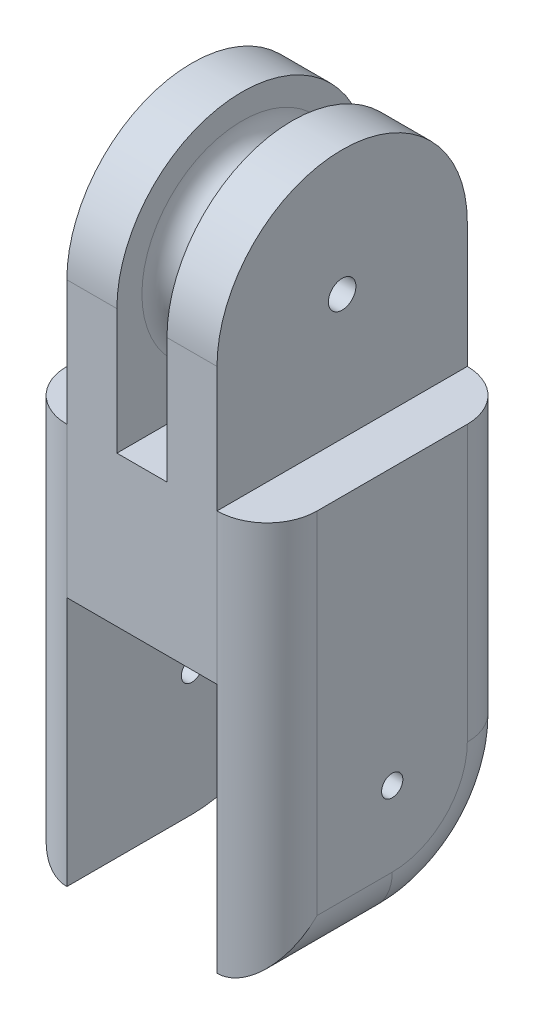
from build123d import *

# Parameters (mm, degrees)
SKETCH1_W           = 20
SKETCH1_H           = 20
BOSS_EXTRUDE1_DEPTH = 12
SKETCH4_W           = 4
SKETCH4_H           = 20
BOSS_EXTRUDE2_DEPTH = 10
BOSS_EXTRUDE3_DEPTH = 4
BOSS_EXTRUDE4_START = -4
BOSS_EXTRUDE4_DEPTH = 4
SKETCH7_R           = 0.85
CUT_EXTRUDE1_DEPTH  = 31
FILLET1_R           = 4
SKETCH8_W           = 4
SKETCH8_H           = 20
BOSS_EXTRUDE5_DEPTH = 10
SKETCH9_R           = 10
BOSS_EXTRUDE6_DEPTH = 4
BOSS_EXTRUDE7_START = -4
SKETCH10_R          = 10
BOSS_EXTRUDE7_DEPTH = 4
SKETCH12_R          = 1.1
CUT_EXTRUDE2_DEPTH  = 38.148351242
SKETCH13_R          = 6
BOSS_EXTRUDE8_DEPTH = 4
SKETCH14_R          = 1.1
CUT_EXTRUDE3_DEPTH  = 4
FILLET2_R           = 2
CUT_EXTRUDE4_REACH  = 36.986
SKETCH16_R          = 0.5


with BuildPart() as part:
    # Sketch1 → Boss-Extrude1 (new body)
    with BuildSketch(Plane(origin=(0, 0, 0), x_dir=(1, 0, 0), z_dir=(0, 1, 0))):
        Rectangle(SKETCH1_W, SKETCH1_H)
    extrude(amount=BOSS_EXTRUDE1_DEPTH)

    # Sketch4 → Boss-Extrude2 (add)
    with BuildSketch(Plane.XZ):
        with Locations((-8, 0)):
            Rectangle(SKETCH4_W, SKETCH4_H)
        with Locations((8, 0)):
            Rectangle(SKETCH4_W, SKETCH4_H)
    extrude(amount=BOSS_EXTRUDE2_DEPTH)

    # Sketch5 → Boss-Extrude3 (add)
    with BuildSketch(Plane.ZY.offset(10)):
        with BuildLine():
            Line((0, -20), (10, -20))
            Line((10, -20), (10, -10))
            ThreePointArc((10, -10), (-7.071067812, -2.928932188), (0, -20))
        make_face()
    extrude(amount=-BOSS_EXTRUDE3_DEPTH)

    # Sketch6 → Boss-Extrude4 (add)
    with BuildSketch(Plane(origin=(10, 0, 0), x_dir=(0, 0, -1), z_dir=(1, 0, 0)).offset(BOSS_EXTRUDE4_START)):
        with BuildLine():
            Line((0, -20), (-10, -20))
            Line((-10, -20), (-10, -10))
            ThreePointArc((-10, -10), (7.071067812, -2.928932188), (0, -20))
        make_face()
    extrude(amount=BOSS_EXTRUDE4_DEPTH)

    # Sketch7 → Cut-Extrude1 (cut, through all)
    with BuildSketch(Plane.ZY.offset(10)):
        with Locations((0, -10)):
            Circle(SKETCH7_R)
    extrude(amount=-CUT_EXTRUDE1_DEPTH, mode=Mode.SUBTRACT)

    # Fillet1
    fillet1_edges = [part.edges().sort_by_distance(p)[0] for p in [
        (-10, -4, 10),
        (-10, -17.071067812, -7.071067812),
        (10, -4, 10),
        (10, -17.071067812, -7.071067812),
        (-10, 1, -10),
        (10, 1, -10),
        (10, -20, 5),
        (-10, -20, 5),
    ]]
    fillet(fillet1_edges, radius=FILLET1_R - 0.0001)  # a hair under: the kernel refuses the full size

    # Sketch8 → Boss-Extrude5 (add)
    with BuildSketch(Plane(origin=(0, 12, 0), x_dir=(1, 0, 0), z_dir=(0, 1, 0))):
        with Locations((4, 0)):
            Rectangle(SKETCH8_W, SKETCH8_H)
        with Locations((-4, 0)):
            Rectangle(SKETCH8_W, SKETCH8_H)
    extrude(amount=BOSS_EXTRUDE5_DEPTH)

    # Sketch9 → Boss-Extrude6 (add)
    with BuildSketch(Plane(origin=(6, 0, 0), x_dir=(0, 0, -1), z_dir=(1, 0, 0))):
        with Locations((0, 22)):
            Circle(SKETCH9_R)
    extrude(amount=-BOSS_EXTRUDE6_DEPTH)

    # Sketch10 → Boss-Extrude7 (add)
    with BuildSketch(Plane.ZY.offset(6).offset(BOSS_EXTRUDE7_START)):
        with Locations((0, 22)):
            Circle(SKETCH10_R)
    extrude(amount=BOSS_EXTRUDE7_DEPTH)

    # Sketch12 → Cut-Extrude2 (cut, through all)
    with BuildSketch(Plane.ZY.offset(6)):
        with Locations((0, 22)):
            Circle(SKETCH12_R)
    extrude(amount=-CUT_EXTRUDE2_DEPTH, mode=Mode.SUBTRACT)

    # Sketch13 → Boss-Extrude8 (add)
    with BuildSketch(Plane(origin=(-2, 0, 0), x_dir=(0, 0, -1), z_dir=(1, 0, 0))):
        with Locations(Location((0, 22, 0), (0, 0, 180))):
            Circle(SKETCH13_R)
    extrude(amount=BOSS_EXTRUDE8_DEPTH)

    # Sketch14 → Cut-Extrude3 (cut)
    with BuildSketch(Plane(origin=(-2, 0, 0), x_dir=(0, 0, -1), z_dir=(1, 0, 0))):
        with Locations(Location((0, 22, 0), (0, 0, 180))):
            Circle(SKETCH14_R)
    extrude(amount=CUT_EXTRUDE3_DEPTH, mode=Mode.SUBTRACT)

    # Fillet2
    fillet2_edges = [part.edges().sort_by_distance(p)[0] for p in [
        (-2, 22, -6),
        (2, 22, -6),
    ]]
    fillet(fillet2_edges, radius=FILLET2_R - 0.0001)  # a hair under: the kernel refuses the full size

    # Sketch16 → Cut-Extrude4 (cut, up to next)
    with BuildSketch(Plane.XZ, mode=Mode.PRIVATE) as cut_extrude4_sk1:
        with Locations(Location((0, -6, 0), (0, 0, 270))):
            Circle(SKETCH16_R)
    cut_extrude4_tool1 = extrude(cut_extrude4_sk1.sketch, amount=-CUT_EXTRUDE4_REACH, mode=Mode.PRIVATE) & part.part
    # Sketch16 → Cut-Extrude4 (cut, up to next)
    with BuildSketch(Plane.XZ, mode=Mode.PRIVATE) as cut_extrude4_sk2:
        with Locations(Location((0, 6, 0), (0, 0, 90))):
            Circle(SKETCH16_R)
    cut_extrude4_tool2 = extrude(cut_extrude4_sk2.sketch, amount=-CUT_EXTRUDE4_REACH, mode=Mode.PRIVATE) & part.part
    add(cut_extrude4_tool1.solids().sort_by_distance((0, 0, -6))[0], mode=Mode.SUBTRACT)
    add(cut_extrude4_tool2.solids().sort_by_distance((0, 0, 6))[0], mode=Mode.SUBTRACT)


solid = part.part
